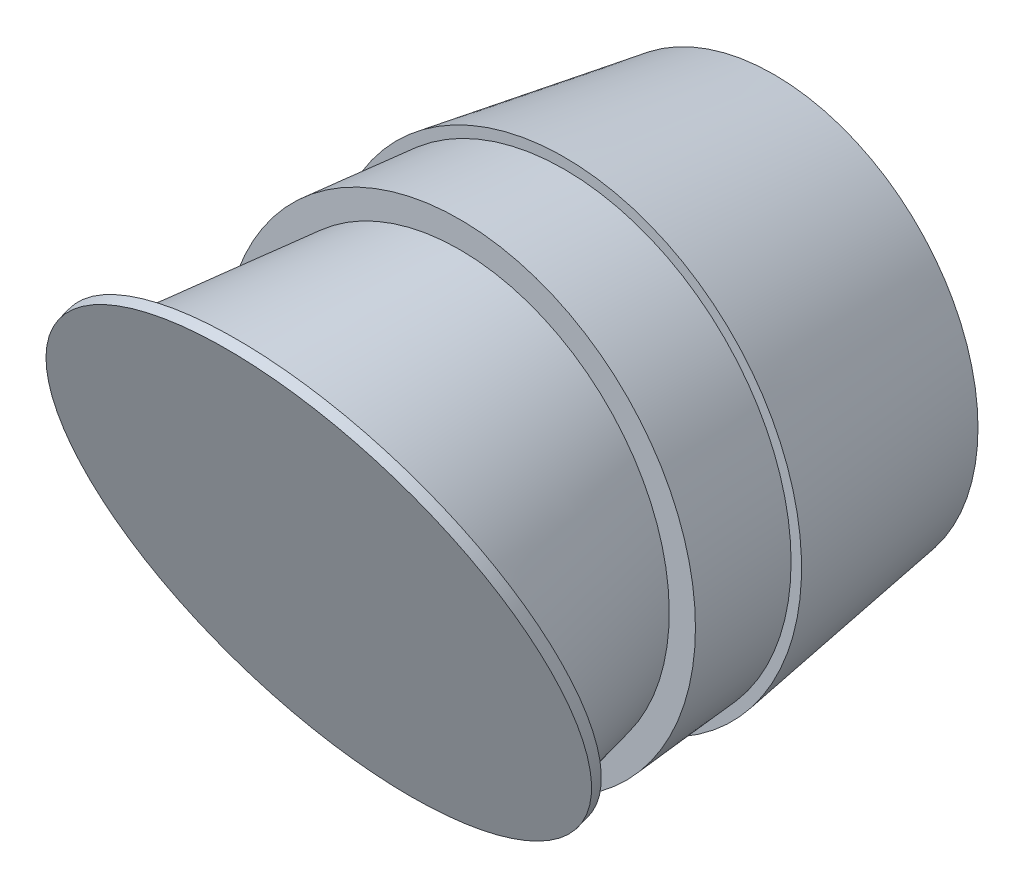
from build123d import *

# Parameters (mm, degrees)
SKETCH1_R           = 11.25
BOSS_EXTRUDE1_DEPTH = 5
BOSS_EXTRUDE1_DRAFT = -5
SKETCH4_R           = 11.312556682
BOSS_EXTRUDE2_DEPTH = 10
BOSS_EXTRUDE2_TAPER = 9
SKETCH3_R           = 11.25
SKETCH1_38_R        = 10
SKETCH3_7_R         = 12.25
BOSS_EXTRUDE4_DEPTH = 0.5


with BuildPart() as part:
    # Sketch1 → Boss-Extrude1 (with draft: the straight prism first)
    with BuildSketch(Plane.XY):
        Circle(SKETCH1_R)
    extrude(amount=-BOSS_EXTRUDE1_DEPTH)
    # Boss-Extrude1: the draft: its side faces are tilted about the plane it starts from
    boss_extrude1_sides = [part.faces().sort_by_distance(p)[0] for p in [
        (-11.25, 0, -2.5),
    ]]
    draft(boss_extrude1_sides, Plane.XY, BOSS_EXTRUDE1_DRAFT)

    # Sketch4 → Boss-Extrude2 (add)
    with BuildSketch(Plane(origin=(0, 0, -5), x_dir=(-1, 0, 0), z_dir=(0, 0, -1))):
        Circle(SKETCH4_R)
    extrude(amount=BOSS_EXTRUDE2_DEPTH, taper=BOSS_EXTRUDE2_TAPER)

    # Sketch3 → Loft2 section 0
    with BuildSketch(Plane(origin=(0, -2.247482777, 5.854892806), x_dir=(1, 0, 0), z_dir=(0, -0.358367949545301, 0.9335804264972015))):
        with Locations((0, 2.407379925)):
            Circle(SKETCH3_R)
    # Sketch1<38> → Loft2 section 1
    with BuildSketch(Plane.XY):
        Circle(SKETCH1_38_R)
    loft()

    # Sketch3<7> → Boss-Extrude4 (add)
    with BuildSketch(Plane(origin=(0, -2.247482777, 5.854892806), x_dir=(1, 0, 0), z_dir=(0, -0.358367949545301, 0.9335804264972015))):
        with Locations(Location((0, 2.407379925, 0), (0, 0, 270))):
            Circle(SKETCH3_7_R)
    extrude(amount=-BOSS_EXTRUDE4_DEPTH)


solid = part.part
